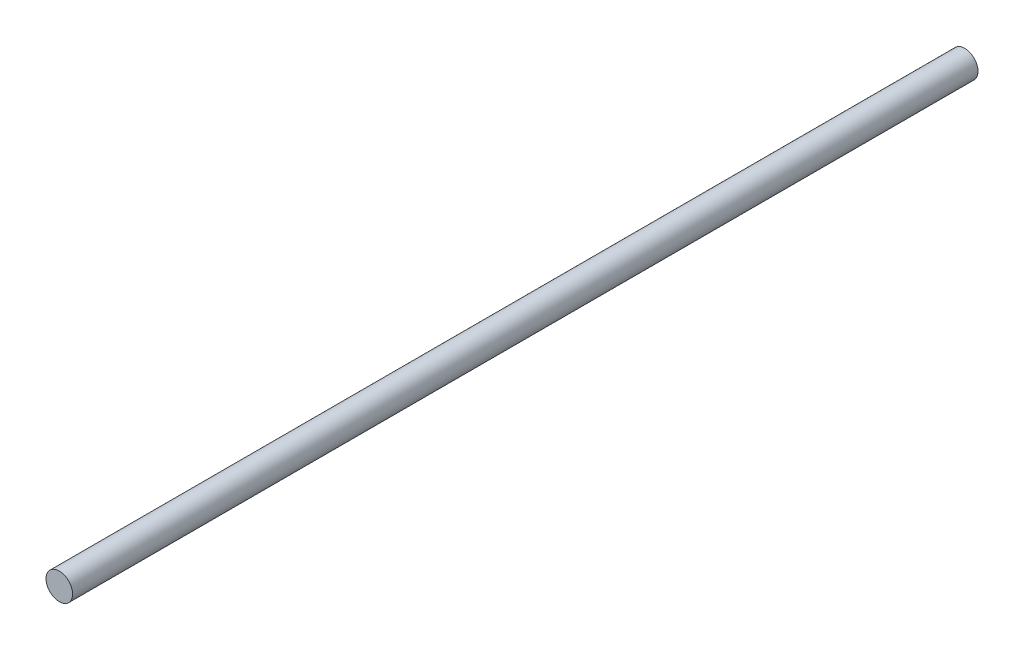
from build123d import *

# Parameters (mm, degrees)
SKETCH1_R           = 6.35
BOSS_EXTRUDE1_DEPTH = 432.562


with BuildPart() as part:
    # Sketch1 → Boss-Extrude1 (new body)
    with BuildSketch(Plane.XY):
        Circle(SKETCH1_R)
    extrude(amount=BOSS_EXTRUDE1_DEPTH)


solid = part.part
